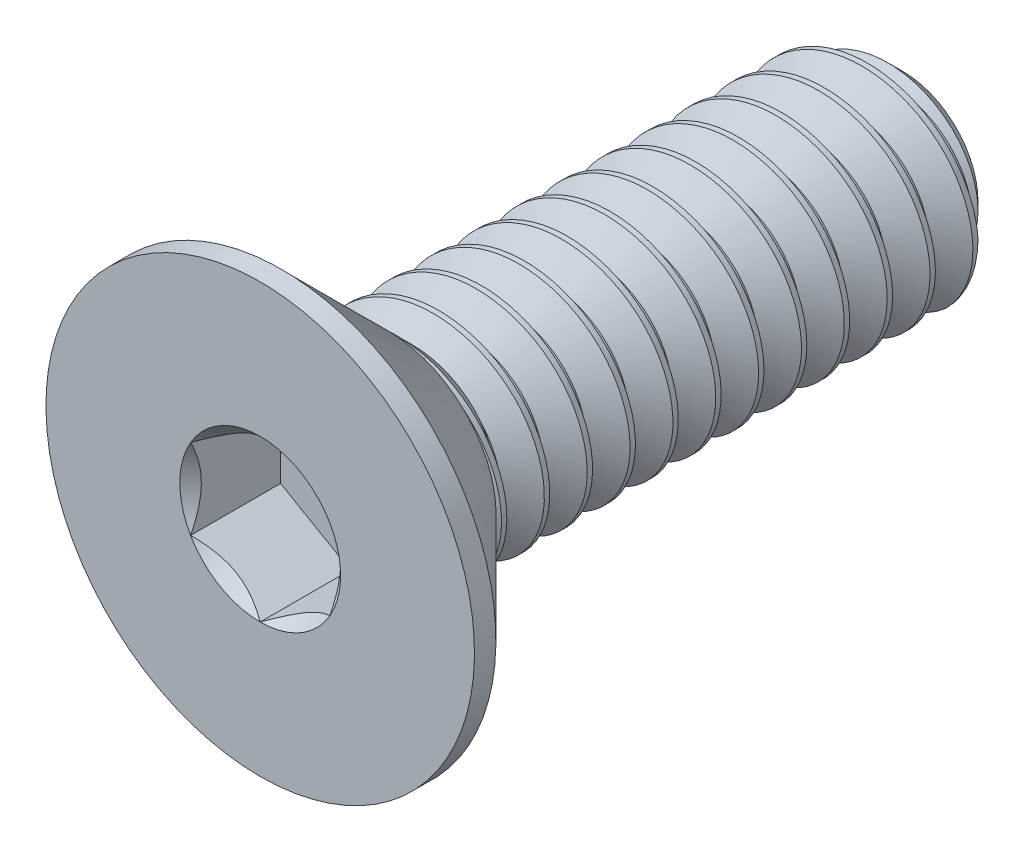
from build123d import *
from build123d.topology import SkipClean

# Parameters (mm, degrees)
SKETCH1_W          = 6
SKETCH1_H          = 1
CHAMFER1_SIZE      = 0.3
CUT_SWEEP1_PITCH   = 0.4
CUT_EXTRUDE2_DEPTH = 0.84


with BuildPart() as part:
    # Sketch1 → Revolve1 (revolve)
    with BuildSketch(Plane(origin=(0, 0, 0), x_dir=(0, 0, -1), z_dir=(1, 0, 0))):
        with Locations((3, 0.5)):
            Rectangle(SKETCH1_W, SKETCH1_H)
    revolve(axis=Axis((0, 0, -6), (0, 0, 1)))

    # Chamfer1
    chamfer1_edges = [part.edges().sort_by_distance(p)[0] for p in [
        (0, -1, -6),
    ]]
    chamfer(chamfer1_edges, length=CHAMFER1_SIZE)

    # Cut-Sweep1: the profile of Sketch2 profile screwed along a right-hand helix of 15 turns, 6 arcs to a turn; built about Z, then put on its axis
    cut_sweep1_z = Axis((0, 0, 0), (0, 0, 1))
    cut_sweep1_corners = [(1.0006, 0, 0.00034641), (1.0006, 0, -0.35034641), (0.740192379, 0, -0.2), (0.740192379, 0, -0.15)]
    with BuildLine(mode=Mode.PRIVATE) as cut_sweep1_profile:
        Line(cut_sweep1_corners[0], cut_sweep1_corners[1])
        Line(cut_sweep1_corners[1], cut_sweep1_corners[2])
        Line(cut_sweep1_corners[2], cut_sweep1_corners[3])
        Line(cut_sweep1_corners[3], cut_sweep1_corners[0])
    cut_sweep1_cap = Face(cut_sweep1_profile.wire())
    cut_sweep1_turn_angles = [0, 30, 60, 90, 120, 150, 180, 210, 240, 270, 300, 330, 360]
    cut_sweep1_turn_weights = [1, 0.8660254037844387, 1, 0.8660254037844387, 1, 0.8660254037844387, 1, 0.8660254037844387, 1, 0.8660254037844387, 1, 0.8660254037844387, 1]
    cut_sweep1_turn_rails = [Edge.make_bspline([Vector(p[0], p[1], 0).rotate(cut_sweep1_z, cut_sweep1_turn_angles[k]) / cut_sweep1_turn_weights[k] + Vector(0, 0, p[2] + CUT_SWEEP1_PITCH * cut_sweep1_turn_angles[k] / 360) for k in range(13)], [0, 0, 0, 1, 1, 2, 2, 3, 3, 4, 4, 5, 5, 6, 6, 6], 2, cut_sweep1_turn_weights) for p in cut_sweep1_corners]
    cut_sweep1_turn_sides = [Face.make_surface_from_curves(cut_sweep1_turn_rails[p[0]], cut_sweep1_turn_rails[p[1]]) for p in [(0, 1), (1, 2), (2, 3), (3, 0)]]
    cut_sweep1 = Plane(origin=(0, 0, -6), x_dir=(0, 1, 0), z_dir=(0, 0, 1)) * Solid(Shell([*[p.moved(Location((0, 0, CUT_SWEEP1_PITCH * i))) for i in range(15) for p in cut_sweep1_turn_sides], cut_sweep1_cap, cut_sweep1_cap.rotate(cut_sweep1_z, 5400).moved(Location((0, 0, CUT_SWEEP1_PITCH * 5400 / 360)))]))
    add(cut_sweep1, mode=Mode.SUBTRACT)

    # Sketch7 → Revolve2 (revolve)
    with BuildSketch(Plane(origin=(0, 0, 0), x_dir=(0, 0, -1), z_dir=(1, 0, 0)), mode=Mode.PRIVATE) as revolve2_sk:
        Polygon((0, 2), (0.2, 2), (1.2, 1), (1.2, 0), (0, 0), align=None)
    revolve(revolve2_sk.sketch.rotate(Axis((0, 0, 0), (0, 0, -1)), 189.336081704), axis=Axis((0, 0, 0), (0, 0, -1)))

    # Boss-Extrude1 cone 1 section (through the dimple's axis) → Boss-Extrude1 (revolve)
    with SkipClean():  # the faces are left unmerged after this step: merging them gives an invalid solid
        with BuildSketch(Plane(origin=(0, 0, -1.2), x_dir=(0, -1, 0), z_dir=(1, 0, 0))):
            Polygon((0, 0), (1, 0), (0, 1), align=None)
        revolve(axis=Axis((0, 0, -1.2), (0, 0, -1)))

    # Sketch5 → Cut-Extrude2 (cut)
    with SkipClean():  # the faces are left unmerged after this step: merging them gives an invalid solid
        with BuildSketch(Plane.XY):
            Polygon((0.65, -0.375277675), (0.65, 0.375277675), (0, 0.75055535), (-0.65, 0.375277675), (-0.65, -0.375277675), (0, -0.75055535), align=None)
        extrude(amount=-CUT_EXTRUDE2_DEPTH, mode=Mode.SUBTRACT)

    # Cut-Extrude3 cone 1 section (through the dimple's axis) → Cut-Extrude3 (revolve, cut)
    with SkipClean():  # the faces are left unmerged after this step: merging them gives an invalid solid
        with BuildSketch(Plane(origin=(0, 0, 0), x_dir=(0, -1, 0), z_dir=(1, 0, 0))):
            Polygon((0, 0), (0.75055535, 0), (0, 0.75055535), align=None)
        revolve(axis=Axis((0, 0, 0), (0, 0, -1)), mode=Mode.SUBTRACT)


solid = part.part
